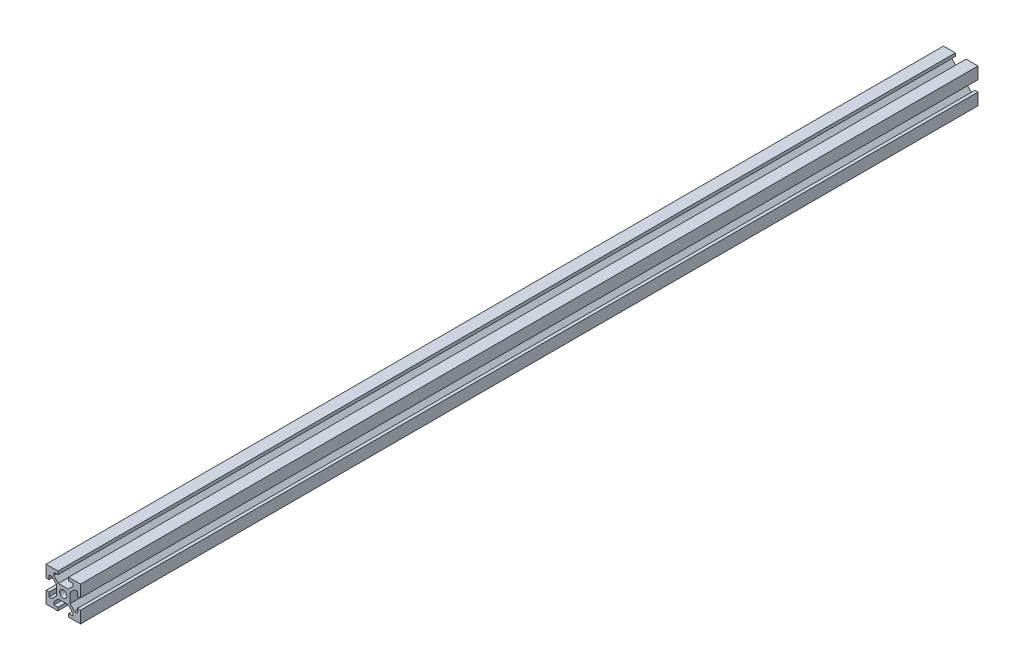
from build123d import *

# Parameters (mm, degrees)
BOSS_EXTRUDE1_DEPTH = 520
SKETCH2_R           = 2.1
CUT_EXTRUDE1_DEPTH  = 521.192272146
SKETCH3_R           = 2.1
CUT_EXTRUDE2_DEPTH  = 521.281873943


with BuildPart() as part:
    # Sketch1 → Boss-Extrude1 (new body)
    with BuildSketch(Plane.XY):
        Polygon((-3.1, 10), (-3.1, 8.200660172), (-5.5, 8.200660172), (-5.5, 6.560660172), (-2.84, 3.900660172), (2.84, 3.900660172), (5.5, 6.560660172), (5.5, 8.200660172), (3.1, 8.200660172), (3.1, 10), (10, 10), (10, 3.1), (8.200660172, 3.1), (8.200660172, 5.5), (6.560660172, 5.5), (3.900660172, 2.84), (3.900660172, -2.84), (6.560660172, -5.5), (8.200660172, -5.5), (8.200660172, -3.1), (10, -3.1), (10, -10), (3.1, -10), (3.1, -8.200660172), (5.5, -8.200660172), (5.5, -6.560660172), (2.84, -3.900660172), (-2.84, -3.900660172), (-5.5, -6.560660172), (-5.5, -8.200660172), (-3.1, -8.200660172), (-3.1, -10), (-10, -10), (-10, -3.1), (-8.200660172, -3.1), (-8.200660172, -5.5), (-6.560660172, -5.5), (-3.900660172, -2.84), (-3.900660172, 2.84), (-6.560660172, 5.5), (-8.200660172, 5.5), (-8.200660172, 3.1), (-10, 3.1), (-10, 10), align=None)
    extrude(amount=BOSS_EXTRUDE1_DEPTH)

    # Sketch2 → Cut-Extrude1 (cut, through all)
    with BuildSketch(Plane.XY.offset(520)):
        Circle(SKETCH2_R)
    extrude(amount=-CUT_EXTRUDE1_DEPTH, mode=Mode.SUBTRACT)

    # Sketch3 → Cut-Extrude2 (cut, through all)
    with BuildSketch(Plane(origin=(0, 3.900660172, 0), x_dir=(1, 0, 0), z_dir=(0, 1, 0))):
        with Locations((0, -260)):
            Circle(SKETCH3_R)
    extrude(amount=-CUT_EXTRUDE2_DEPTH, mode=Mode.SUBTRACT)


solid = part.part
